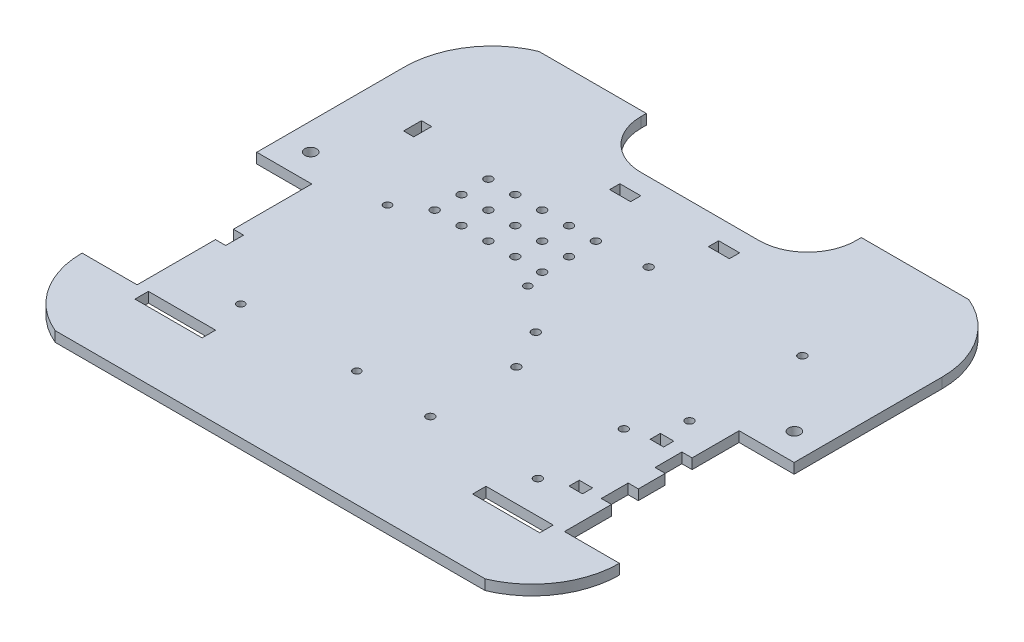
from build123d import *

# Parameters (mm, degrees)
SKETCH1_W           = 254
SKETCH1_H           = 228.6
BOSS_EXTRUDE1_DEPTH = 4.826
SKETCH2_W           = 26.00000007
SKETCH2_H           = 82.55
CUT_EXTRUDE1_DEPTH  = 4.826
CUT_EXTRUDE3_DEPTH  = 4.826
SKETCH7_W           = 101.6
SKETCH7_H           = 25.4
CUT_EXTRUDE5_DEPTH  = 4.826
FILLET9_R           = 22.86
FILLET10_R          = 22.86
CUT_EXTRUDE6_DEPTH  = 4.826
SKETCH9_W           = 31.75
SKETCH9_H           = 6.35
CUT_EXTRUDE7_DEPTH  = 171.929167423
SKETCH11_W          = 9.906
SKETCH11_H          = 4.826
CUT_EXTRUDE8_DEPTH  = 171.929167423
SKETCH13_R          = 1.905
CUT_EXTRUDE10_DEPTH = 171.929167423
SKETCH14_R          = 1.778
CUT_EXTRUDE11_DEPTH = 171.929167423
SKETCH15_R          = 1.905
CUT_EXTRUDE12_DEPTH = 171.929167423
SKETCH16_R          = 1.905
CUT_EXTRUDE13_DEPTH = 171.929167423
SKETCH17_R          = 2.778125
CUT_EXTRUDE14_DEPTH = 171.929167423
SKETCH18_W          = 4.826
SKETCH18_H          = 12.7
CUT_EXTRUDE15_DEPTH = 171.929167423
SKETCH19_W          = 4.826
SKETCH19_H          = 8.466666666
CUT_EXTRUDE16_DEPTH = 171.929167423
SKETCH20_W          = 6.35
SKETCH20_H          = 4.826
CUT_EXTRUDE17_DEPTH = 4.826


with BuildPart() as part:
    # Sketch1 → Boss-Extrude1 (new body)
    with BuildSketch(Plane(origin=(0, 0, 0), x_dir=(1, 0, 0), z_dir=(0, 1, 0))):
        Rectangle(SKETCH1_W, SKETCH1_H)
    extrude(amount=BOSS_EXTRUDE1_DEPTH)

    # Sketch2 → Cut-Extrude1 (cut)
    with BuildSketch(Plane(origin=(0, 4.826, 0), x_dir=(1, 0, 0), z_dir=(0, 1, 0))):
        with Locations((-113.999999965, -34.925)):
            Rectangle(SKETCH2_W, SKETCH2_H)
        with Locations((113.999999965, -34.925)):
            Rectangle(SKETCH2_W, SKETCH2_H)
    extrude(amount=-CUT_EXTRUDE1_DEPTH, mode=Mode.SUBTRACT)

    # Sketch4 → Cut-Extrude3 (cut)
    with BuildSketch(Plane(origin=(0, 4.826, 0), x_dir=(1, 0, 0), z_dir=(0, 1, 0))):
        with BuildLine():
            Line((-127, 76.2), (-127, 114.3))
            Line((-127, 114.3), (-101.6, 114.3))
            ThreePointArc((-101.6, 114.3), (-120.067875899, 99.095250599), (-127, 76.2))
        make_face()
        with BuildLine():
            Line((127, 76.2), (127, 114.3))
            Line((127, 114.3), (101.6, 114.3))
            ThreePointArc((101.6, 114.3), (120.067875899, 99.095250599), (127, 76.2))
        make_face()
    extrude(amount=-CUT_EXTRUDE3_DEPTH, mode=Mode.SUBTRACT)

    # Sketch7 → Cut-Extrude5 (cut)
    with BuildSketch(Plane(origin=(0, 4.826, 0), x_dir=(1, 0, 0), z_dir=(0, 1, 0))):
        with Locations((0, 101.6)):
            Rectangle(SKETCH7_W, SKETCH7_H)
    extrude(amount=-CUT_EXTRUDE5_DEPTH, mode=Mode.SUBTRACT)

    # Fillet9
    fillet9_edges = [part.edges().sort_by_distance(p)[0] for p in [
        (-50.8, 2.413, -88.9),
    ]]
    fillet(fillet9_edges, radius=FILLET9_R)

    # Fillet10
    fillet10_edges = [part.edges().sort_by_distance(p)[0] for p in [
        (50.8, 2.413, -88.9),
    ]]
    fillet(fillet10_edges, radius=FILLET10_R)

    # Sketch8 → Cut-Extrude6 (cut)
    with BuildSketch(Plane(origin=(0, 4.826, 0), x_dir=(1, 0, 0), z_dir=(0, 1, 0))):
        with BuildLine():
            Line((-127, -76.2), (-127, -114.3))
            Line((-127, -114.3), (-101.6, -114.3))
            ThreePointArc((-101.6, -114.3), (-120.067875899, -99.095250599), (-127, -76.2))
        make_face()
        with BuildLine():
            Line((127, -114.3), (101.6, -114.3))
            ThreePointArc((101.6, -114.3), (120.067875899, -99.095250599), (127, -76.2))
            Line((127, -76.2), (127, -114.3))
        make_face()
    extrude(amount=-CUT_EXTRUDE6_DEPTH, mode=Mode.SUBTRACT)

    # Sketch9 → Cut-Extrude7 (cut, through all)
    with BuildSketch(Plane.XZ):
        with Locations((-79.79099993, 79.375)):
            Rectangle(SKETCH9_W, SKETCH9_H)
        with Locations((79.79099993, 79.375)):
            Rectangle(SKETCH9_W, SKETCH9_H)
    extrude(amount=-CUT_EXTRUDE7_DEPTH, mode=Mode.SUBTRACT)

    # Sketch11 → Cut-Extrude8 (cut, through all)
    with BuildSketch(Plane(origin=(0, 4.826, 0), x_dir=(1, 0, 0), z_dir=(0, 1, 0))):
        with Locations((-23.345869789, 76.863822677)):
            Rectangle(SKETCH11_W, SKETCH11_H)
        with Locations((23.345869789, 76.863822677)):
            Rectangle(SKETCH11_W, SKETCH11_H)
    extrude(amount=-CUT_EXTRUDE8_DEPTH, mode=Mode.SUBTRACT)

    # Sketch13 → Cut-Extrude10 (cut, through all)
    with BuildSketch(Plane(origin=(0, 4.826, 0), x_dir=(1, 0, 0), z_dir=(0, 1, 0))):
        with Locations((-10.4749371, 24.715879034)):
            Circle(SKETCH13_R)
        with Locations((-23.1749371, 24.715879034)):
            Circle(SKETCH13_R)
        with Locations((-35.8749371, 24.715879034)):
            Circle(SKETCH13_R)
        with Locations((-48.5749371, 24.715879034)):
            Circle(SKETCH13_R)
        with Locations((-61.2749371, 24.715879034)):
            Circle(SKETCH13_R)
        with Locations((-23.1749371, 37.415879034)):
            Circle(SKETCH13_R)
        with Locations((-35.8749371, 37.415879034)):
            Circle(SKETCH13_R)
        with Locations((-48.5749371, 37.415879034)):
            Circle(SKETCH13_R)
        with Locations((-61.2749371, 37.415879034)):
            Circle(SKETCH13_R)
        with Locations((-23.1749371, 50.115879034)):
            Circle(SKETCH13_R)
        with Locations((-35.8749371, 50.115879034)):
            Circle(SKETCH13_R)
        with Locations((-48.5749371, 50.115879034)):
            Circle(SKETCH13_R)
        with Locations((-61.2749371, 50.115879034)):
            Circle(SKETCH13_R)
        with Locations((-10.4749371, 37.415879034)):
            Circle(SKETCH13_R)
        with Locations((-10.4749371, 50.115879034)):
            Circle(SKETCH13_R)
    extrude(amount=-CUT_EXTRUDE10_DEPTH, mode=Mode.SUBTRACT)

    # Sketch14 → Cut-Extrude11 (cut, through all)
    with BuildSketch(Plane(origin=(0, 4.826, 0), x_dir=(1, 0, 0), z_dir=(0, 1, 0))):
        with Locations((-68.6409371, -59.556843517)):
            Circle(SKETCH14_R)
        with Locations((-13.7769371, -59.556843517)):
            Circle(SKETCH14_R)
        with Locations((-74.4829371, 15.627156483)):
            Circle(SKETCH14_R)
        with Locations((-8.1889371, 15.627156483)):
            Circle(SKETCH14_R)
    extrude(amount=-CUT_EXTRUDE11_DEPTH, mode=Mode.SUBTRACT)

    # Sketch15 → Cut-Extrude12 (cut, through all)
    with BuildSketch(Plane(origin=(0, 4.826, 0), x_dir=(1, 0, 0), z_dir=(0, 1, 0))):
        with Locations((22.218290503, -60.795548144)):
            Circle(SKETCH15_R)
        with Locations((22.218290503, -20.155548144)):
            Circle(SKETCH15_R)
        with Locations((73.018290503, -60.795548144)):
            Circle(SKETCH15_R)
        with Locations((73.018290503, -20.155548144)):
            Circle(SKETCH15_R)
    extrude(amount=-CUT_EXTRUDE12_DEPTH, mode=Mode.SUBTRACT)

    # Sketch16 → Cut-Extrude13 (cut, through all)
    with BuildSketch(Plane(origin=(0, 4.826, 0), x_dir=(1, 0, 0), z_dir=(0, 1, 0))):
        with Locations((85.253150773, -1.36459374)):
            Circle(SKETCH16_R)
        with Locations((12.609150773, -1.36459374)):
            Circle(SKETCH16_R)
        with Locations((12.609150773, 51.97540626)):
            Circle(SKETCH16_R)
        with Locations((85.253150773, 51.97540626)):
            Circle(SKETCH16_R)
    extrude(amount=-CUT_EXTRUDE13_DEPTH, mode=Mode.SUBTRACT)

    # Sketch17 → Cut-Extrude14 (cut, through all)
    with BuildSketch(Plane.XZ):
        with Locations((114.3, -19.164632523)):
            Circle(SKETCH17_R)
        with Locations((-114.3, -19.164632523)):
            Circle(SKETCH17_R)
    extrude(amount=-CUT_EXTRUDE14_DEPTH, mode=Mode.SUBTRACT)

    # Sketch18 → Cut-Extrude15 (cut, through all)
    with BuildSketch(Plane(origin=(0, 4.826, 0), x_dir=(1, 0, 0), z_dir=(0, 1, 0))):
        with Locations((98.58699993, -47.625)):
            Rectangle(SKETCH18_W, SKETCH18_H)
        with Locations((98.58699993, -22.225)):
            Rectangle(SKETCH18_W, SKETCH18_H)
    extrude(amount=-CUT_EXTRUDE15_DEPTH, mode=Mode.SUBTRACT)

    # Sketch19 → Cut-Extrude16 (cut, through all)
    with BuildSketch(Plane(origin=(0, 4.826, 0), x_dir=(1, 0, 0), z_dir=(0, 1, 0))):
        with Locations((-98.58699993, -34.925)):
            Rectangle(SKETCH19_W, SKETCH19_H)
        with Locations((-98.58699993, 53.975)):
            Rectangle(SKETCH19_W, SKETCH19_H)
    extrude(amount=-CUT_EXTRUDE16_DEPTH, mode=Mode.SUBTRACT)

    # Sketch20 → Cut-Extrude17 (cut)
    with BuildSketch(Plane.XZ):
        with Locations((86.64899993, 54.102)):
            Rectangle(SKETCH20_W, SKETCH20_H)
        with Locations((86.64899993, 15.748)):
            Rectangle(SKETCH20_W, SKETCH20_H)
    extrude(amount=-CUT_EXTRUDE17_DEPTH, mode=Mode.SUBTRACT)


solid = part.part
